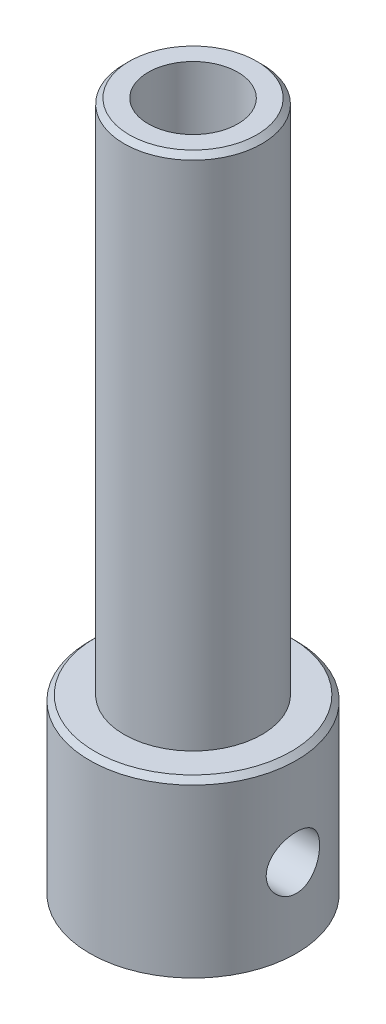
from build123d import *

# Parameters (mm, degrees)
SKETCH6_R               = 6
BOSS_EXTRUDE4_DEPTH     = 10
SKETCH7_R               = 4
BOSS_EXTRUDE5_DEPTH     = 30
CHAMFER1_SIZE           = 0.3
CHAMFER2_SIZE           = 0.3
CUT_EXTRUDE4_DEPTH      = 43.190046219
CUT_EXTRUDE4_DEPTH_BACK = 43.190046219
SKETCH10_R              = 1.55
CUT_EXTRUDE5_DEPTH      = 41.89009673
CUT_EXTRUDE5_DEPTH_BACK = 41.89009673
SKETCH11_R              = 2.6


with BuildPart() as part:
    # Sketch6 → Boss-Extrude4 (new body)
    with BuildSketch(Plane(origin=(0, 0, 0), x_dir=(1, 0, 0), z_dir=(0, 1, 0))):
        Circle(SKETCH6_R)
    extrude(amount=BOSS_EXTRUDE4_DEPTH)

    # Sketch7 → Boss-Extrude5 (add)
    with BuildSketch(Plane(origin=(0, 10, 0), x_dir=(1, 0, 0), z_dir=(0, 1, 0))):
        Circle(SKETCH7_R)
    extrude(amount=BOSS_EXTRUDE5_DEPTH)

    # Chamfer1
    chamfer1_edges = [part.edges().sort_by_distance(p)[0] for p in [
        (-4, 40, 0),
    ]]
    chamfer(chamfer1_edges, length=CHAMFER1_SIZE)

    # Chamfer2
    chamfer2_edges = [part.edges().sort_by_distance(p)[0] for p in [
        (-6, 10, 0),
    ]]
    chamfer(chamfer2_edges, length=CHAMFER2_SIZE)

    # Sketch10 → Cut-Extrude4 (cut, two sides: drawn at the far end of the back side and taken through both)
    with BuildSketch(Plane.ZY.offset(6).offset(-CUT_EXTRUDE4_DEPTH_BACK)):
        with Locations((0, 4.567060469)):
            Circle(SKETCH10_R)
    extrude(amount=CUT_EXTRUDE4_DEPTH + CUT_EXTRUDE4_DEPTH_BACK, mode=Mode.SUBTRACT)

    # Sketch11 → Cut-Extrude5 (cut, two sides: drawn at the far end of the back side and taken through both)
    with BuildSketch(Plane(origin=(0, 40, 0), x_dir=(1, 0, 0), z_dir=(0, 1, 0)).offset(-CUT_EXTRUDE5_DEPTH_BACK)):
        Circle(SKETCH11_R)
    extrude(amount=CUT_EXTRUDE5_DEPTH + CUT_EXTRUDE5_DEPTH_BACK, mode=Mode.SUBTRACT)


solid = part.part
